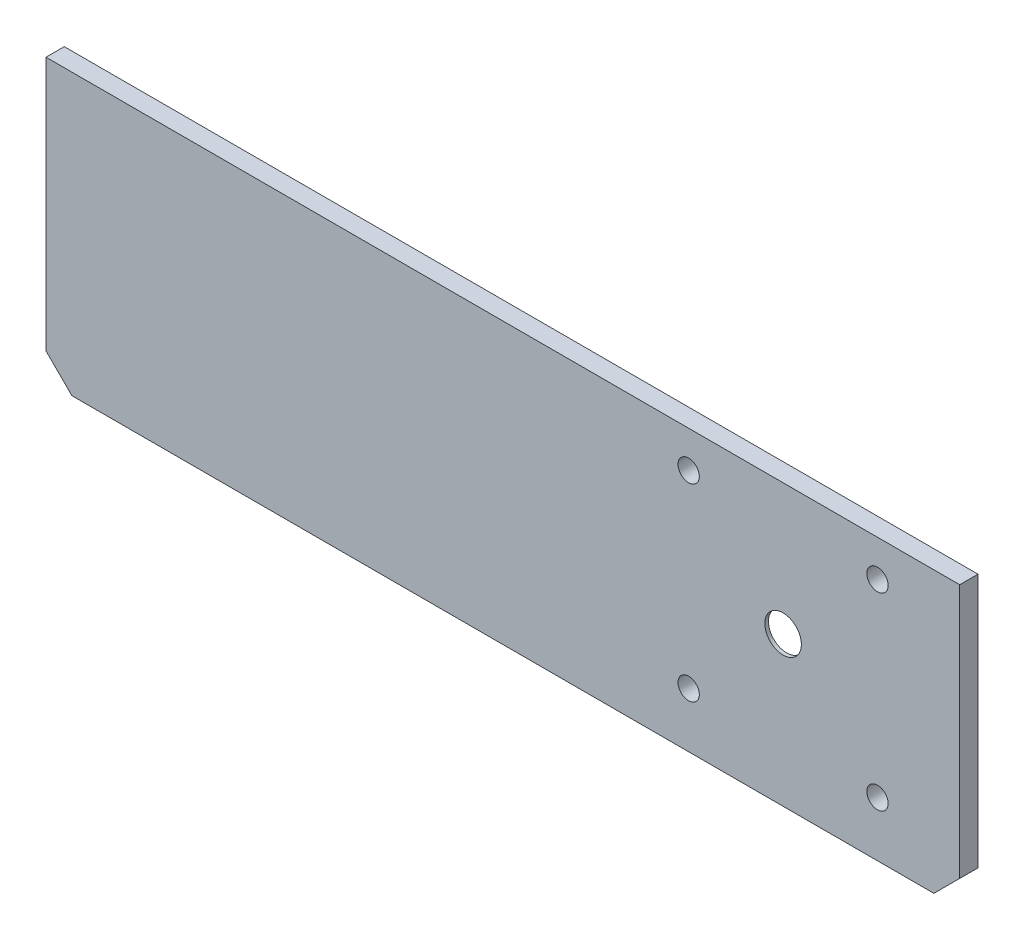
from build123d import *

# Parameters (mm, degrees)
SKETCH1_R           = 1.75
SKETCH1_R_2         = 3
BOSS_EXTRUDE1_DEPTH = 3
SKETCH2_R           = 11.45
CUT_EXTRUDE1_DEPTH  = 2.4


with BuildPart() as part:
    # Sketch1 → Boss-Extrude1 (new body)
    with BuildSketch(Plane.XY):
        Polygon((-121, 21.5), (29, 21.5), (29, -20.257359313), (24.757359313, -24.5), (-116.757359313, -24.5), (-121, -20.257359313), align=None)
        with Locations((15.5, 15.5)):
            Circle(SKETCH1_R, mode=Mode.SUBTRACT)
        with Locations((-15.5, 15.5)):
            Circle(SKETCH1_R, mode=Mode.SUBTRACT)
        with Locations((15.5, -15.5)):
            Circle(SKETCH1_R, mode=Mode.SUBTRACT)
        with Locations((-15.5, -15.5)):
            Circle(SKETCH1_R, mode=Mode.SUBTRACT)
        Circle(SKETCH1_R_2, mode=Mode.SUBTRACT)
    extrude(amount=BOSS_EXTRUDE1_DEPTH)

    # Sketch2 → Cut-Extrude1 (cut)
    with BuildSketch(Plane(origin=(0, 0, 0), x_dir=(-1, 0, 0), z_dir=(0, 0, -1))):
        Circle(SKETCH2_R)
    extrude(amount=-CUT_EXTRUDE1_DEPTH, mode=Mode.SUBTRACT)


solid = part.part
